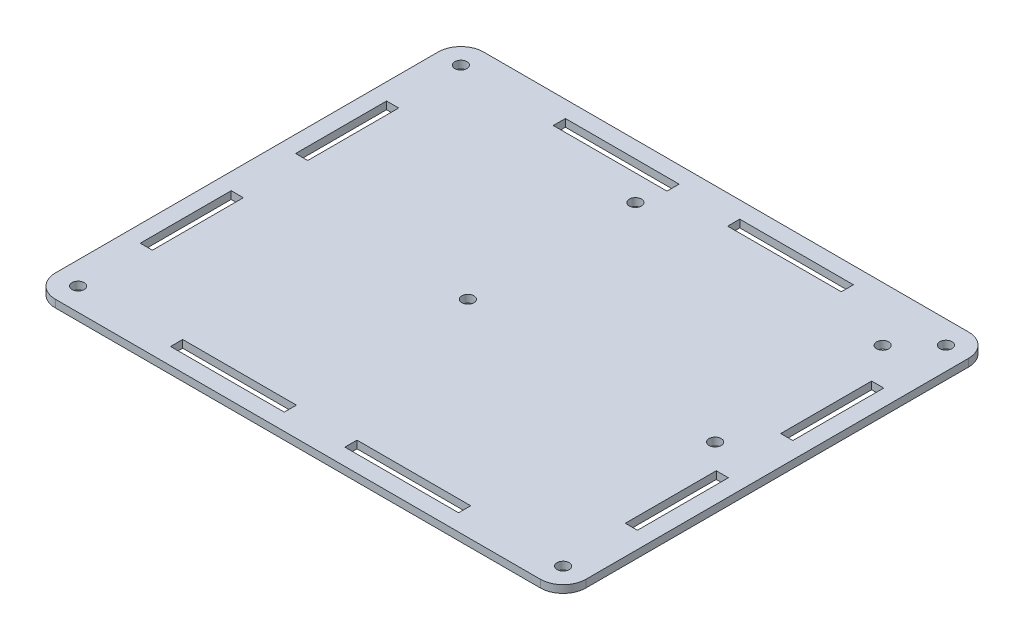
from build123d import *

# Parameters (mm, degrees)
SKETCH1_W           = 140
SKETCH1_H           = 113
SKETCH1_R           = 1.6
SKETCH1_W_2         = 3.2
SKETCH1_H_2         = 24
SKETCH1_W_3         = 30
SKETCH1_H_3         = 3.2
BOSS_EXTRUDE1_DEPTH = 2
FILLET1_R           = 6
FILLET2_R           = 6
FILLET3_R           = 6


with BuildPart() as part:
    # Sketch1 → Boss-Extrude1 (new body)
    with BuildSketch(Plane(origin=(0, 0, 0), x_dir=(1, 0, 0), z_dir=(0, 1, 0))):
        with Locations((70, 56.5)):
            Rectangle(SKETCH1_W, SKETCH1_H)
        with Locations((60.437, 98.62)):
            Circle(SKETCH1_R, mode=Mode.SUBTRACT)
        with Locations((125.69, 98.62)):
            Circle(SKETCH1_R, mode=Mode.SUBTRACT)
        with Locations((125.69, 54.418)):
            Circle(SKETCH1_R, mode=Mode.SUBTRACT)
        with Locations((60.437, 54.418)):
            Circle(SKETCH1_R, mode=Mode.SUBTRACT)
        with Locations((6, 107)):
            Circle(SKETCH1_R, mode=Mode.SUBTRACT)
        with Locations((134, 107)):
            Circle(SKETCH1_R, mode=Mode.SUBTRACT)
        with Locations((134, 6)):
            Circle(SKETCH1_R, mode=Mode.SUBTRACT)
        with Locations((6, 6)):
            Circle(SKETCH1_R, mode=Mode.SUBTRACT)
        with Locations((134, 36)):
            Rectangle(SKETCH1_W_2, SKETCH1_H_2, mode=Mode.SUBTRACT)
        with Locations((47, 6)):
            Rectangle(SKETCH1_W_3, SKETCH1_H_3, mode=Mode.SUBTRACT)
        with Locations((47, 107)):
            Rectangle(SKETCH1_W_3, SKETCH1_H_3, mode=Mode.SUBTRACT)
        with Locations((93, 6)):
            Rectangle(SKETCH1_W_3, SKETCH1_H_3, mode=Mode.SUBTRACT)
        with Locations((6, 77)):
            Rectangle(SKETCH1_W_2, SKETCH1_H_2, mode=Mode.SUBTRACT)
        with Locations((6, 36)):
            Rectangle(SKETCH1_W_2, SKETCH1_H_2, mode=Mode.SUBTRACT)
        with Locations((93, 107)):
            Rectangle(SKETCH1_W_3, SKETCH1_H_3, mode=Mode.SUBTRACT)
        with Locations((134, 77)):
            Rectangle(SKETCH1_W_2, SKETCH1_H_2, mode=Mode.SUBTRACT)
    extrude(amount=BOSS_EXTRUDE1_DEPTH)

    # Fillet1
    fillet1_edges = [part.edges().sort_by_distance(p)[0] for p in [
        (0, 1, -113),
    ]]
    fillet(fillet1_edges, radius=FILLET1_R)

    # Fillet2
    fillet2_edges = [part.edges().sort_by_distance(p)[0] for p in [
        (0, 1, 0),
    ]]
    fillet(fillet2_edges, radius=FILLET2_R)

    # Fillet3
    fillet3_edges = [part.edges().sort_by_distance(p)[0] for p in [
        (140, 1, -113),
        (140, 1, 0),
    ]]
    fillet(fillet3_edges, radius=FILLET3_R)


solid = part.part
